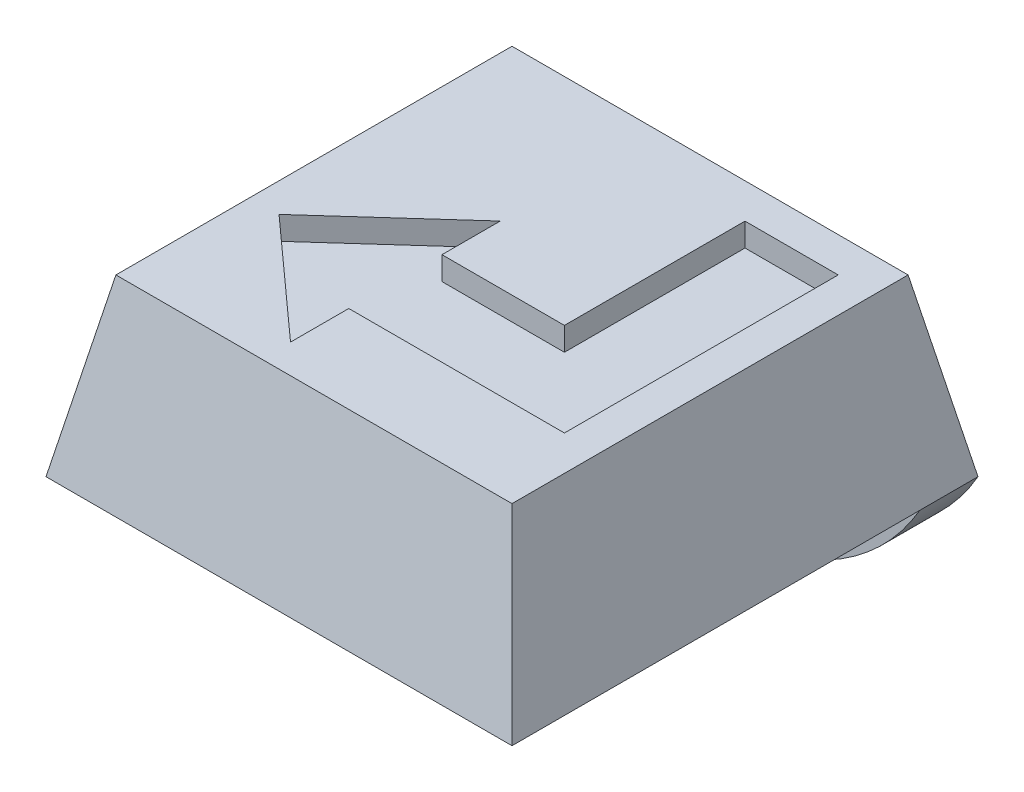
from build123d import *

# Parameters (mm, degrees)
SKETCH1_W               = 8
SKETCH1_H               = 8
BOSS_EXTRUDE1_DEPTH     = 3
CUT_EXTRUDE1_DEPTH      = 12.704699911
CUT_EXTRUDE1_DEPTH_BACK = 12.704699911
CUT_EXTRUDE2_DEPTH      = 11
SKETCH4_R               = 1.75
CUT_EXTRUDE3_DEPTH      = 0.4
SKETCH5_W               = 8
SKETCH5_H               = 1
BOSS_EXTRUDE2_DEPTH     = 2
FILLET1_R               = 4
SKETCH6_W               = 2.10217216
SKETCH6_H               = 1.6
CUT_EXTRUDE4_DEPTH      = 0.4


with BuildPart() as part:
    # Sketch1 → Boss-Extrude1 (new body)
    with BuildSketch(Plane(origin=(0, 0, 0), x_dir=(1, 0, 0), z_dir=(0, 1, 0))):
        with Locations((4, 4)):
            Rectangle(SKETCH1_W, SKETCH1_H)
    extrude(amount=BOSS_EXTRUDE1_DEPTH)

    # Sketch2 → Cut-Extrude1 (cut, two sides: drawn at the far end of the back side and taken through both)
    with BuildSketch(Plane.XY.offset(-CUT_EXTRUDE1_DEPTH_BACK)):
        Polygon((0, 0), (0.6, 3), (0, 3), align=None)
        Polygon((8, 0), (7.4, 3), (8, 3), align=None)
    extrude(amount=CUT_EXTRUDE1_DEPTH + CUT_EXTRUDE1_DEPTH_BACK, mode=Mode.SUBTRACT)

    # Sketch3 → Cut-Extrude2 (cut)
    with BuildSketch(Plane(origin=(0, 0, 0), x_dir=(0, 0, -1), z_dir=(1, 0, 0))):
        Polygon((0, 0), (0.6, 3), (0, 3), align=None)
        Polygon((8, 3), (7.4, 3), (8, 0), align=None)
    extrude(amount=CUT_EXTRUDE2_DEPTH, mode=Mode.SUBTRACT)

    # Sketch4 → Cut-Extrude3 (cut)
    with BuildSketch(Plane.XZ):
        with Locations(Location((4, -3.75, 0), (0, 0, 270))):
            Circle(SKETCH4_R)
    extrude(amount=-CUT_EXTRUDE3_DEPTH, mode=Mode.SUBTRACT)

    # Sketch5 → Boss-Extrude2 (add)
    with BuildSketch(Plane.XZ):
        with Locations((4, -7.5)):
            Rectangle(SKETCH5_W, SKETCH5_H)
    extrude(amount=BOSS_EXTRUDE2_DEPTH)

    # Fillet1
    # the kernel refuses this fillet: 4 mm, written as the material it takes off along each edge
    with BuildSketch(Plane(origin=(8, -2, -16.660254038), x_dir=(0, 1, 0), z_dir=(0, 0, 1)), Plane(origin=(0, -2, 1.660254038), x_dir=(0, 1, 0), z_dir=(0, 0, -1))) as fillet1_piece_1:
        with BuildLine():
            CenterArc((4, 3.464101615), FILLET1_R, 180, 60)
            Line((0, 3.464101615), (-0.08, 3.464101615))
            Line((-0.08, 3.464101615), (-0.08, 0))
            Line((-0.08, 0), (0, -0.08))
            ThreePointArc((0, -0.08), (1, -0.08), (1.96, -0.069282032))
            Line((1.96, -0.069282032), (2, 0))
        make_face()
    extrude(amount=18.320508076, mode=Mode.SUBTRACT)

    # Sketch6 → Cut-Extrude4 (cut)
    with BuildSketch(Plane(origin=(0, 3, 0), x_dir=(1, 0, 0), z_dir=(0, 1, 0))):
        Polygon((3.09782784, 2.1), (3.09782784, 3.7), (3.09782784, 4.7), (1.1, 2.9), (3.09782784, 1.1), align=None)
        with Locations((4.14891392, 2.9)):
            Rectangle(SKETCH6_W, SKETCH6_H)
        Polygon((5.2, 6.8), (5.2, 3.7), (5.2, 2.1), (6.8, 2.1), (6.8, 6.8), align=None)
    extrude(amount=-CUT_EXTRUDE4_DEPTH, mode=Mode.SUBTRACT)


solid = part.part
